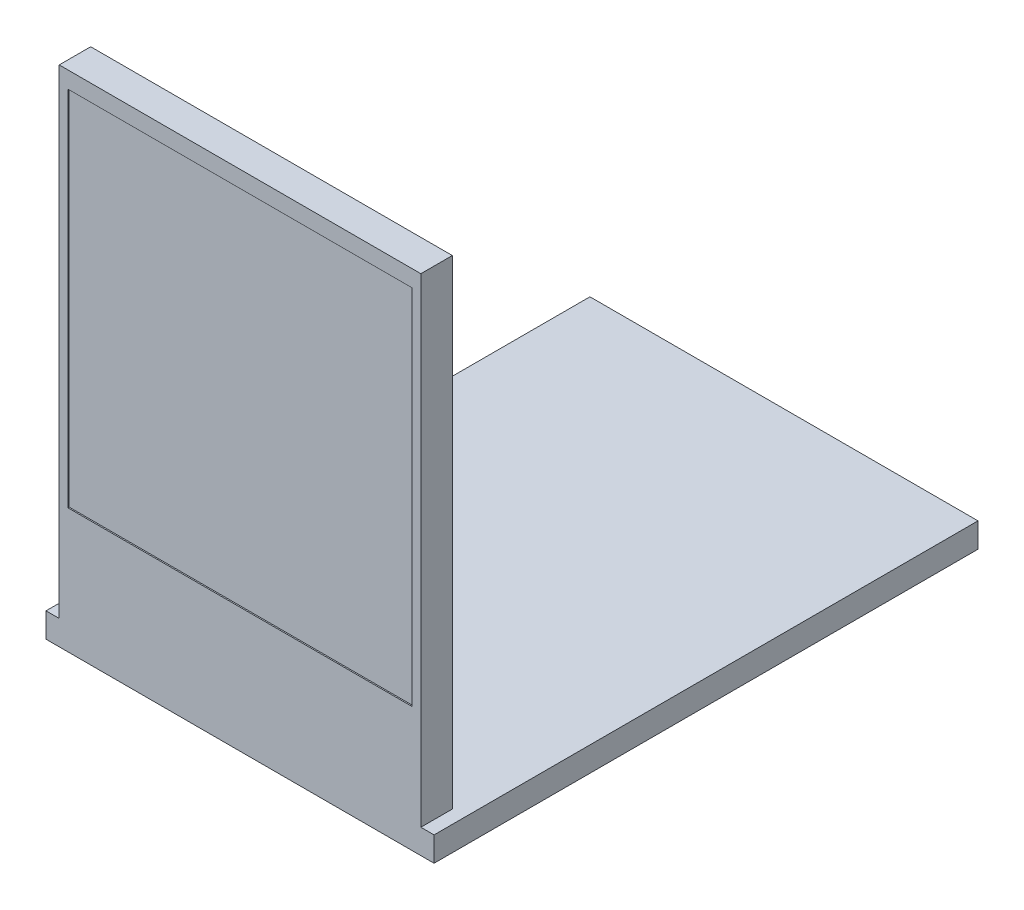
from build123d import *

# Parameters (mm, degrees)
SKETCH1_W           = 31.57
SKETCH1_H           = 44.25
BOSS_EXTRUDE1_DEPTH = 2
SKETCH2_W           = 29.42
SKETCH2_H           = 39
BOSS_EXTRUDE2_DEPTH = 2.56
SKETCH3_W           = 28
SKETCH3_H           = 29.5
CUT_EXTRUDE1_DEPTH  = 0.1


with BuildPart() as part:
    # Sketch1 → Boss-Extrude1 (new body)
    with BuildSketch(Plane(origin=(0, 0, 0), x_dir=(1, 0, 0), z_dir=(0, 1, 0))):
        with Locations((0, 22.125)):
            Rectangle(SKETCH1_W, SKETCH1_H)
    extrude(amount=-BOSS_EXTRUDE1_DEPTH)

    # Sketch2 → Boss-Extrude2 (add)
    with BuildSketch(Plane.XY):
        with Locations((0, 19.5)):
            Rectangle(SKETCH2_W, SKETCH2_H)
    extrude(amount=-BOSS_EXTRUDE2_DEPTH)

    # Sketch3 → Cut-Extrude1 (cut)
    with BuildSketch(Plane.XY):
        with Locations((0, 22.9)):
            Rectangle(SKETCH3_W, SKETCH3_H)
    extrude(amount=-CUT_EXTRUDE1_DEPTH, mode=Mode.SUBTRACT)


solid = part.part
